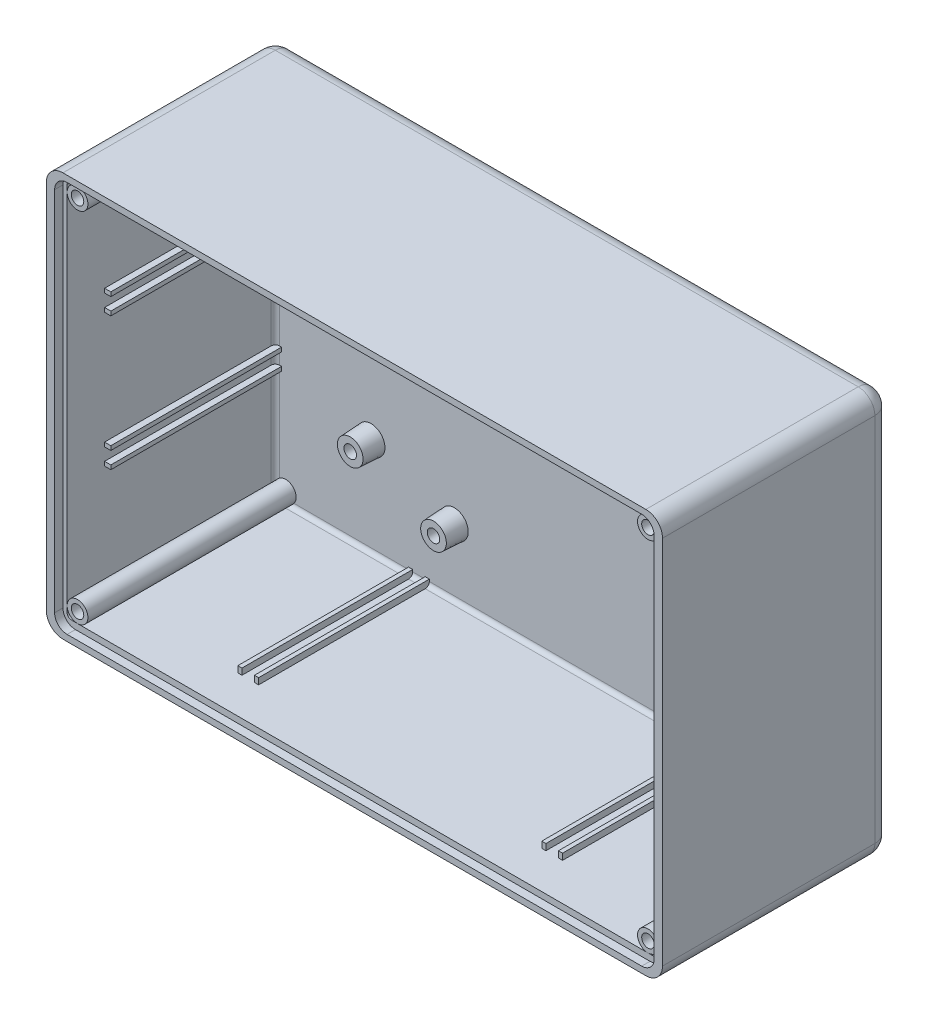
from build123d import *

# Parameters (mm, degrees)
ESBO_O1_W            = 148
ESBO_O1_H            = 97
CAIXA_PB_114_2_DEPTH = 55
FILETE2_R            = 4
CASCA1_T             = -3
ESBO_O3_R            = 3.5
ESBO_O3_R_2          = 1.5
EXTRUS_O3_DEPTH      = 5
EXTRUS_O2_DEPTH      = 2
ESBO_O4_W            = 2
ESBO_O4_H            = 1
ESBO_O4_W_2          = 1
ESBO_O4_H_2          = 2
EXTRUS_O4_DEPTH      = 41
ESBO_O5_R            = 2.5
ESBO_O5_R_2          = 1.5
EXTRUS_O7_DEPTH      = 50
EXTRUS_O7_2_DEPTH    = 50
EXTRUS_O7_3_DEPTH    = 50
EXTRUS_O7_4_DEPTH    = 50


# Read off the part's stored shape, not the designer's step: Inclinação1
with BuildPart() as part:
    # Esboço1 → Caixa PB 114/2 (new body)
    with BuildSketch(Plane.XY):
        Rectangle(ESBO_O1_W, ESBO_O1_H)
    extrude(amount=CAIXA_PB_114_2_DEPTH)

    # Filete2
    filete2_edges = [part.edges().sort_by_distance(p)[0] for p in [
        (0, 48.5, 0),
        (74, 0, 0),
        (0, -48.5, 0),
        (-74, 0, 0),
        (-74, 48.5, 27.5),
        (74, 48.5, 27.5),
        (74, -48.5, 27.5),
        (-74, -48.5, 27.5),
    ]]
    fillet(filete2_edges, radius=FILETE2_R)

    # Casca1
    casca1_openings = [part.faces().sort_by_distance(p)[0] for p in [
        (0, 0, 55),
    ]]
    offset(amount=CASCA1_T, openings=casca1_openings, kind=Kind.INTERSECTION)

    # Esboço3 → Extrusão3 (add)
    # profile 1 of 8: a face of its own
    with BuildSketch(Plane.XY.offset(3)):
        with Locations((-48, 22)):
            Circle(ESBO_O3_R)
        with Locations((-48, 22)):
            Circle(ESBO_O3_R_2, mode=Mode.SUBTRACT)
    # profile 2 of 8: a face of its own
    with BuildSketch(Plane.XY.offset(3)):
        with Locations((-28, 29.5)):
            Circle(ESBO_O3_R)
        with Locations((-28, 29.5)):
            Circle(ESBO_O3_R_2, mode=Mode.SUBTRACT)
    # profile 3 of 8: a face of its own
    with BuildSketch(Plane.XY.offset(3)):
        with Locations((-28, -29.5)):
            Circle(ESBO_O3_R)
        with Locations((-28, -29.5)):
            Circle(ESBO_O3_R_2, mode=Mode.SUBTRACT)
    # profile 4 of 8: a face of its own
    with BuildSketch(Plane.XY.offset(3)):
        with Locations((-48, -22)):
            Circle(ESBO_O3_R)
        with Locations((-48, -22)):
            Circle(ESBO_O3_R_2, mode=Mode.SUBTRACT)
    # profile 5 of 8: a face of its own
    with BuildSketch(Plane.XY.offset(3)):
        with Locations((28, 29.5)):
            Circle(ESBO_O3_R)
        with Locations((28, 29.5)):
            Circle(ESBO_O3_R_2, mode=Mode.SUBTRACT)
    # profile 6 of 8: a face of its own
    with BuildSketch(Plane.XY.offset(3)):
        with Locations((48, 22)):
            Circle(ESBO_O3_R)
        with Locations((48, 22)):
            Circle(ESBO_O3_R_2, mode=Mode.SUBTRACT)
    # profile 7 of 8: a face of its own
    with BuildSketch(Plane.XY.offset(3)):
        with Locations((48, -22)):
            Circle(ESBO_O3_R)
        with Locations((48, -22)):
            Circle(ESBO_O3_R_2, mode=Mode.SUBTRACT)
    # profile 8 of 8: a face of its own
    with BuildSketch(Plane.XY.offset(3)):
        with Locations((28, -29.5)):
            Circle(ESBO_O3_R)
        with Locations((28, -29.5)):
            Circle(ESBO_O3_R_2, mode=Mode.SUBTRACT)
    extrude(amount=EXTRUS_O3_DEPTH)

    # Inclinação1 outline → Inclinação1 (revolve, cut)
    with BuildSketch(Plane(origin=(-48, 22, 0), x_dir=(1, 0, 0), z_dir=(0, -1, 0))):
        Polygon((3.080737766, 8), (3.342776662, 3), (3.5, 3), (3.5, 8), align=None)
    revolve(axis=Axis((-48, 22, 0), (0, 0, 1)), mode=Mode.SUBTRACT)

    # Inclina_o1 2 outline → Inclina_o1 2 (revolve, cut)
    with BuildSketch(Plane(origin=(-28, 29.5, 0), x_dir=(1, 0, 0), z_dir=(0, -1, 0))):
        Polygon((3.080737766, 8), (3.342776662, 3), (3.5, 3), (3.5, 8), align=None)
    revolve(axis=Axis((-28, 29.5, 0), (0, 0, 1)), mode=Mode.SUBTRACT)

    # Inclina_o1 3 outline → Inclina_o1 3 (revolve, cut)
    with BuildSketch(Plane(origin=(-28, -29.5, 0), x_dir=(1, 0, 0), z_dir=(0, -1, 0))):
        Polygon((3.080737766, 8), (3.342776662, 3), (3.5, 3), (3.5, 8), align=None)
    revolve(axis=Axis((-28, -29.5, 0), (0, 0, 1)), mode=Mode.SUBTRACT)

    # Inclina_o1 4 outline → Inclina_o1 4 (revolve, cut)
    with BuildSketch(Plane(origin=(-48, -22, 0), x_dir=(1, 0, 0), z_dir=(0, -1, 0))):
        Polygon((3.080737766, 8), (3.342776662, 3), (3.5, 3), (3.5, 8), align=None)
    revolve(axis=Axis((-48, -22, 0), (0, 0, 1)), mode=Mode.SUBTRACT)

    # Inclina_o1 5 outline → Inclina_o1 5 (revolve, cut)
    with BuildSketch(Plane(origin=(28, 29.5, 0), x_dir=(1, 0, 0), z_dir=(0, -1, 0))):
        Polygon((3.080737766, 8), (3.342776662, 3), (3.5, 3), (3.5, 8), align=None)
    revolve(axis=Axis((28, 29.5, 0), (0, 0, 1)), mode=Mode.SUBTRACT)

    # Inclina_o1 6 outline → Inclina_o1 6 (revolve, cut)
    with BuildSketch(Plane(origin=(48, 22, 0), x_dir=(1, 0, 0), z_dir=(0, -1, 0))):
        Polygon((3.080737766, 8), (3.342776662, 3), (3.5, 3), (3.5, 8), align=None)
    revolve(axis=Axis((48, 22, 0), (0, 0, 1)), mode=Mode.SUBTRACT)

    # Inclina_o1 7 outline → Inclina_o1 7 (revolve, cut)
    with BuildSketch(Plane(origin=(48, -22, 0), x_dir=(1, 0, 0), z_dir=(0, -1, 0))):
        Polygon((3.080737766, 8), (3.342776662, 3), (3.5, 3), (3.5, 8), align=None)
    revolve(axis=Axis((48, -22, 0), (0, 0, 1)), mode=Mode.SUBTRACT)

    # Inclina_o1 8 outline → Inclina_o1 8 (revolve, cut)
    with BuildSketch(Plane(origin=(28, -29.5, 0), x_dir=(1, 0, 0), z_dir=(0, -1, 0))):
        Polygon((3.080737766, 8), (3.342776662, 3), (3.5, 3), (3.5, 8), align=None)
    revolve(axis=Axis((28, -29.5, 0), (0, 0, 1)), mode=Mode.SUBTRACT)

    # Esboço2 → Extrusão2 (cut)
    with BuildSketch(Plane.XY.offset(55)):
        with BuildLine():
            Line((-69, 47), (69, 47))
            ThreePointArc((69, 47), (71.121320344, 46.121320344), (72, 44))
            Line((72, 44), (72, -44))
            ThreePointArc((72, -44), (71.121320344, -46.121320344), (69, -47))
            Line((69, -47), (-69, -47))
            ThreePointArc((-69, -47), (-71.121320344, -46.121320344), (-72, -44))
            Line((-72, -44), (-72, 44))
            ThreePointArc((-72, 44), (-71.121320344, 46.121320344), (-69, 47))
        make_face()
    extrude(amount=-EXTRUS_O2_DEPTH, mode=Mode.SUBTRACT)

    # Esboço4 → Extrusão4 (add)
    with BuildSketch(Plane.XY.offset(3)):
        with Locations((-70.5, -14)):
            Rectangle(ESBO_O4_W, ESBO_O4_H)
        with Locations((-70.5, -18)):
            Rectangle(ESBO_O4_W, ESBO_O4_H)
        with Locations((70.5, -14)):
            Rectangle(ESBO_O4_W, ESBO_O4_H)
        with Locations((70.5, -18)):
            Rectangle(ESBO_O4_W, ESBO_O4_H)
        with Locations((-70.5, 14)):
            Rectangle(ESBO_O4_W, ESBO_O4_H)
        with Locations((-70.5, 18)):
            Rectangle(ESBO_O4_W, ESBO_O4_H)
        with Locations((70.5, 18)):
            Rectangle(ESBO_O4_W, ESBO_O4_H)
        with Locations((70.5, 14)):
            Rectangle(ESBO_O4_W, ESBO_O4_H)
        with Locations((-38.5, 45)):
            Rectangle(ESBO_O4_W_2, ESBO_O4_H_2)
        with Locations((-34.5, 45)):
            Rectangle(ESBO_O4_W_2, ESBO_O4_H_2)
        with Locations((34.5, 45)):
            Rectangle(ESBO_O4_W_2, ESBO_O4_H_2)
        with Locations((38.5, 45)):
            Rectangle(ESBO_O4_W_2, ESBO_O4_H_2)
        with Locations((-38.5, -45)):
            Rectangle(ESBO_O4_W_2, ESBO_O4_H_2)
        with Locations((-34.5, -45)):
            Rectangle(ESBO_O4_W_2, ESBO_O4_H_2)
        with Locations((34.5, -45)):
            Rectangle(ESBO_O4_W_2, ESBO_O4_H_2)
        with Locations((38.5, -45)):
            Rectangle(ESBO_O4_W_2, ESBO_O4_H_2)
    extrude(amount=EXTRUS_O4_DEPTH)


with BuildPart() as body_2:
    # Esboço5 → Extrusão7 (new body)
    with BuildSketch(Plane.XY.offset(3)):
        with Locations((-68.5, 43)):
            Circle(ESBO_O5_R)
        with Locations((-68.5, 43)):
            Circle(ESBO_O5_R_2, mode=Mode.SUBTRACT)
    extrude(amount=EXTRUS_O7_DEPTH)


with BuildPart() as body_3:
    # Esboço5 → Extrus_o7 2 (new body)
    with BuildSketch(Plane.XY.offset(3)):
        with Locations((68.5, 43)):
            Circle(ESBO_O5_R)
        with Locations((68.5, 43)):
            Circle(ESBO_O5_R_2, mode=Mode.SUBTRACT)
    extrude(amount=EXTRUS_O7_2_DEPTH)


with BuildPart() as body_4:
    # Esboço5 → Extrus_o7 3 (new body)
    with BuildSketch(Plane.XY.offset(3)):
        with Locations((68.5, -43)):
            Circle(ESBO_O5_R)
        with Locations((68.5, -43)):
            Circle(ESBO_O5_R_2, mode=Mode.SUBTRACT)
    extrude(amount=EXTRUS_O7_3_DEPTH)


with BuildPart() as body_5:
    # Esboço5 → Extrus_o7 4 (new body)
    with BuildSketch(Plane.XY.offset(3)):
        with Locations((-68.5, -43)):
            Circle(ESBO_O5_R)
        with Locations((-68.5, -43)):
            Circle(ESBO_O5_R_2, mode=Mode.SUBTRACT)
    extrude(amount=EXTRUS_O7_4_DEPTH)


solid = Compound([part.part, body_2.part, body_3.part, body_4.part, body_5.part])
